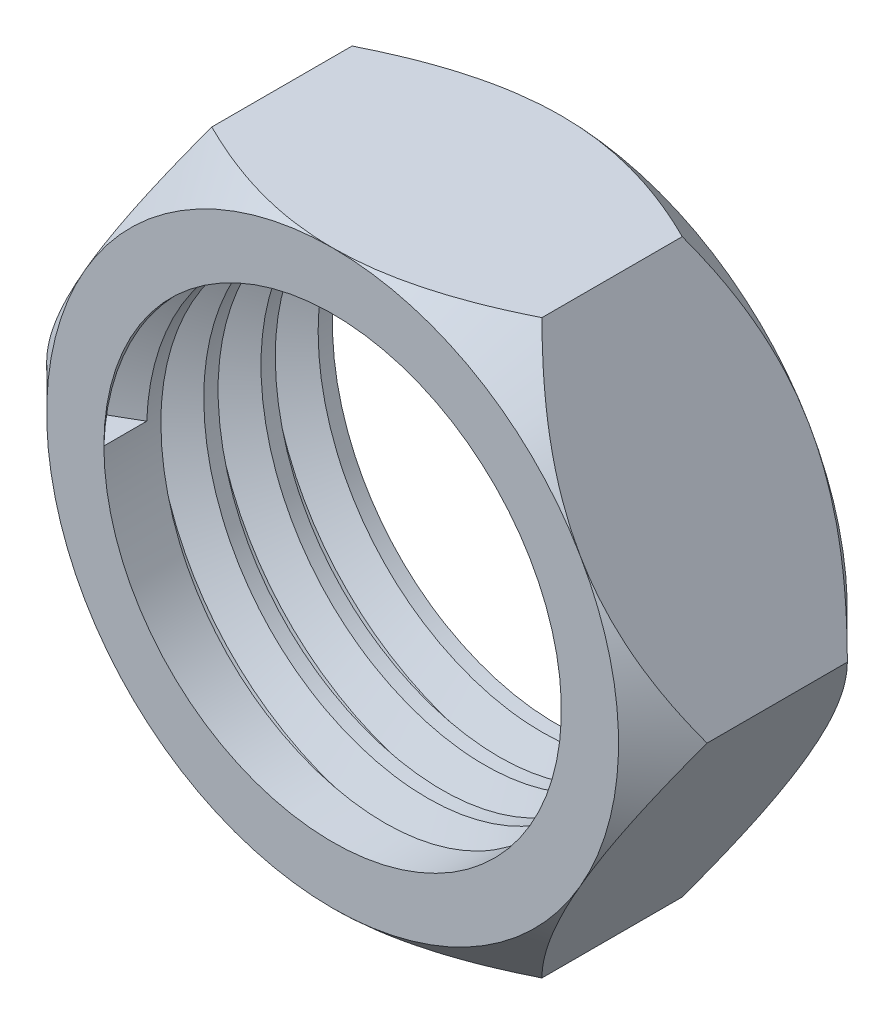
from build123d import *

# Parameters (mm, degrees)
BOSS_EXTRUDE1_DEPTH = 1
CUT_EXTRUDE1_REACH  = 4.155
SKETCH1_3_R         = 1
SKETCH1_4_OUTSIDE_W = 7.676
SKETCH1_4_OUTSIDE_H = 7.29
SKETCH1_4_OUTSIDE_R = 1.25
CUT_EXTRUDE2_DEPTH  = 1
CUT_EXTRUDE2_DRAFT  = 45
SKETCH2_OUTSIDE_W   = 7.676
SKETCH2_OUTSIDE_H   = 7.29
SKETCH2_OUTSIDE_R   = 1.25
CUT_EXTRUDE3_DEPTH  = 1
CUT_EXTRUDE3_DRAFT  = -45
THREAD1_PITCH       = 0.25


with BuildPart() as part:
    # Sketch1 → Boss-Extrude1 (new body)
    with BuildSketch(Plane.XY):
        Polygon((1.443375673, 0), (0.721687836, 1.25), (-0.721687836, 1.25), (-1.443375673, 0), (-0.721687836, -1.25), (0.721687836, -1.25), align=None)
    extrude(amount=BOSS_EXTRUDE1_DEPTH)

    # Sketch1<3> → Cut-Extrude1 (cut, up to next)
    with BuildSketch(Plane.XY, mode=Mode.PRIVATE) as cut_extrude1_sk1:
        Circle(SKETCH1_3_R)
    cut_extrude1_tool1 = extrude(cut_extrude1_sk1.sketch, amount=CUT_EXTRUDE1_REACH, mode=Mode.PRIVATE) & part.part
    add(cut_extrude1_tool1.solids().sort_by_distance((0, 0, 0))[0], mode=Mode.SUBTRACT)


with BuildPart() as cut_extrude2_tool:
    # Sketch1<4> outside → Cut-Extrude2 (with draft: the straight prism first)
    with BuildSketch(Plane.XY):
        Rectangle(SKETCH1_4_OUTSIDE_W, SKETCH1_4_OUTSIDE_H)
        Circle(SKETCH1_4_OUTSIDE_R, mode=Mode.SUBTRACT)
    extrude(amount=CUT_EXTRUDE2_DEPTH)
    # Cut-Extrude2: the draft: its side faces are tilted about the plane it starts from
    cut_extrude2_sides = [cut_extrude2_tool.faces().sort_by_distance(p)[0] for p in [
        (0, -3.645, 0.5),
        (3.838, 0, 0.5),
        (0, 3.645, 0.5),
        (-3.838, 0, 0.5),
        (-1.25, 0, 0.5),
    ]]
    draft(cut_extrude2_sides, Plane.XY, CUT_EXTRUDE2_DRAFT)


with BuildPart() as part_1:
    add(part.part)

    # Cut-Extrude2: cut by cut_extrude2_tool
    add(cut_extrude2_tool.part, mode=Mode.SUBTRACT)


with BuildPart() as cut_extrude3_tool:
    # Sketch2 outside → Cut-Extrude3 (with draft: the straight prism first)
    with BuildSketch(Plane.XY.offset(1)):
        Rectangle(SKETCH2_OUTSIDE_W, SKETCH2_OUTSIDE_H)
        Circle(SKETCH2_OUTSIDE_R, mode=Mode.SUBTRACT)
    extrude(amount=-CUT_EXTRUDE3_DEPTH)
    # Cut-Extrude3: the draft: its side faces are tilted about the plane it starts from
    cut_extrude3_sides = [cut_extrude3_tool.faces().sort_by_distance(p)[0] for p in [
        (0, -3.645, 0.5),
        (3.838, 0, 0.5),
        (0, 3.645, 0.5),
        (-3.838, 0, 0.5),
        (-1.25, 0, 0.5),
    ]]
    draft(cut_extrude3_sides, Plane.XY.offset(1), CUT_EXTRUDE3_DRAFT)


with BuildPart() as part_2:
    add(part_1.part)

    # Cut-Extrude3: cut by cut_extrude3_tool
    add(cut_extrude3_tool.part, mode=Mode.SUBTRACT)

    # Thread1: the profile of Thread Profile1 profile screwed along a right-hand helix of 4 turns, 6 arcs to a turn; built about Z, then put on its axis
    thread1_z = Axis((0, 0, 0), (0, 0, 1))
    thread1_corners = [(0.9997, 0, -0.000173205), (1.135316469, 0, 0.078125), (1.135316469, 0, 0.109375), (0.9997, 0, 0.187673204)]
    with BuildLine(mode=Mode.PRIVATE) as thread1_profile:
        Line(thread1_corners[0], thread1_corners[1])
        Line(thread1_corners[1], thread1_corners[2])
        Line(thread1_corners[2], thread1_corners[3])
        Line(thread1_corners[3], thread1_corners[0])
    thread1_cap = Face(thread1_profile.wire())
    thread1_turn_angles = [0, 30, 60, 90, 120, 150, 180, 210, 240, 270, 300, 330, 360]
    thread1_turn_weights = [1, 0.8660254037844387, 1, 0.8660254037844387, 1, 0.8660254037844387, 1, 0.8660254037844387, 1, 0.8660254037844387, 1, 0.8660254037844387, 1]
    thread1_turn_rails = [Edge.make_bspline([Vector(p[0], p[1], 0).rotate(thread1_z, thread1_turn_angles[k]) / thread1_turn_weights[k] + Vector(0, 0, p[2] + THREAD1_PITCH * thread1_turn_angles[k] / 360) for k in range(13)], [0, 0, 0, 1, 1, 2, 2, 3, 3, 4, 4, 5, 5, 6, 6, 6], 2, thread1_turn_weights) for p in thread1_corners]
    thread1_turn_sides = [Face.make_surface_from_curves(thread1_turn_rails[p[0]], thread1_turn_rails[p[1]]) for p in [(0, 1), (1, 2), (2, 3), (3, 0)]]
    thread1 = Plane(origin=(0, 0, 1), x_dir=(-1, 0, 0), z_dir=(0, 0, -1)) * Solid(Shell([*[p.moved(Location((0, 0, THREAD1_PITCH * i))) for i in range(4) for p in thread1_turn_sides], thread1_cap, thread1_cap.rotate(thread1_z, 1440).moved(Location((0, 0, THREAD1_PITCH * 1440 / 360)))]))
    add(thread1, mode=Mode.SUBTRACT)


solid = part_2.part
